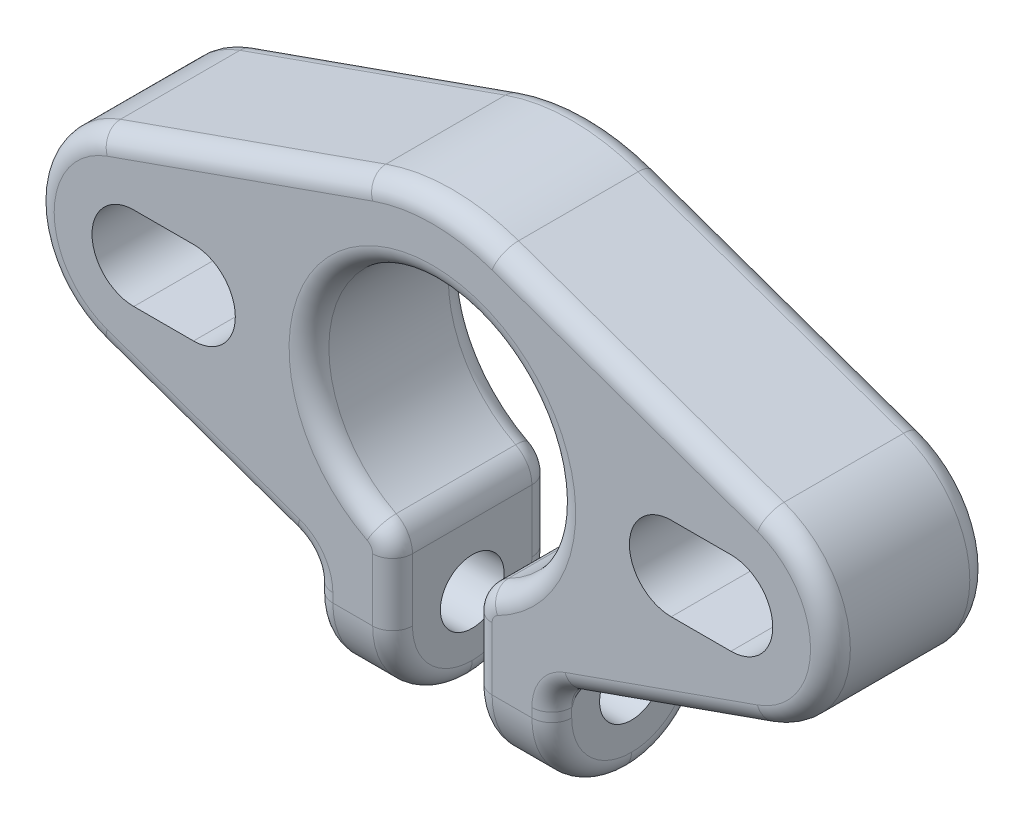
from build123d import *

# Parameters (mm, degrees)
EXTRUDE_1_DEPTH     = 8
FILLET_4_R          = 1.5
CUT_EXTRUDE_START   = 10
SKETCH_2_R          = 1.6
CUT_EXTRUDE_1_DEPTH = 41.594117082
SKETCH_2_3_R        = 3
CUT_EXTRUDE_2_DEPTH = 31.594117108
CUT_EXTRUDE_START_2 = -12
CUT_EXTRUDE_3_DEPTH = 19.594117108
FILLET_1_R          = 4
FILLET_2_R          = 1


with BuildPart() as part:
    # Эскиз1 → Бобышка-Вытянуть1 (new body)
    with BuildSketch(Plane.XY):
        with BuildLine():
            Line((-3.333333333, 9.428090416), (-16.666666667, 4.714045208))
            ThreePointArc((-16.666666667, 4.714045208), (-20, 0), (-16.666666667, -4.714045208))
            Line((-16.666666667, -4.714045208), (-6, -8.485281374))
            Line((-6, -8.485281374), (-6, -14))
            Line((-6, -14), (-2, -14))
            Line((-2, -14), (-2, -5.8685603))
            ThreePointArc((-2, -5.8685603), (0, 6.2), (2, -5.8685603))
            Line((2, -5.8685603), (2, -14))
            Line((2, -14), (6, -14))
            Line((6, -14), (6, -8.485281374))
            Line((6, -8.485281374), (16.666666667, -4.714045208))
            ThreePointArc((16.666666667, -4.714045208), (20, 0), (16.666666667, 4.714045208))
            Line((16.666666667, 4.714045208), (3.333333333, 9.428090416))
            ThreePointArc((3.333333333, 9.428090416), (0, 10), (-3.333333333, 9.428090416))
        make_face()
        with BuildLine():
            Line((-15, 2.1), (-12, 2.1))
            ThreePointArc((-12, 2.1), (-9.9, 0), (-12, -2.1))
            Line((-12, -2.1), (-15, -2.1))
            ThreePointArc((-15, -2.1), (-17.1, 0), (-15, 2.1))
        make_face(mode=Mode.SUBTRACT)
        with BuildLine():
            Line((12, 2.1), (15, 2.1))
            ThreePointArc((15, 2.1), (17.1, 0), (15, -2.1))
            Line((15, -2.1), (12, -2.1))
            ThreePointArc((12, -2.1), (9.9, 0), (12, 2.1))
        make_face(mode=Mode.SUBTRACT)
    extrude(amount=EXTRUDE_1_DEPTH)

    # Скругление4
    fillet_4_edges = [part.edges().sort_by_distance(p)[0] for p in [
        (6, -8.485281374, 4),
        (2, -5.8685603, 4),
        (-2, -5.8685603, 4),
        (-6, -8.485281374, 4),
    ]]
    fillet(fillet_4_edges, radius=FILLET_4_R)

    # Эскиз2 → Вырез-Вытянуть1 (cut, through all)
    with BuildSketch(Plane(origin=(6, 0, 0), x_dir=(0, 0, -1), z_dir=(1, 0, 0)).offset(CUT_EXTRUDE_START)):
        with Locations(Location((-4, -10, 0), (0, 0, 16.486327524))):
            Circle(SKETCH_2_R)
    extrude(amount=-CUT_EXTRUDE_1_DEPTH, mode=Mode.SUBTRACT)

    # Эскиз2<3> → Вырез-Вытянуть2 (cut, through all)
    with BuildSketch(Plane(origin=(6, 0, 0), x_dir=(0, 0, -1), z_dir=(1, 0, 0))):
        with Locations((-4, -10)):
            Circle(SKETCH_2_3_R)
    extrude(amount=CUT_EXTRUDE_2_DEPTH, mode=Mode.SUBTRACT)

    # Эскиз2<4> → Вырез-Вытянуть3 (cut, through all)
    with BuildSketch(Plane(origin=(6, 0, 0), x_dir=(0, 0, -1), z_dir=(1, 0, 0)).offset(CUT_EXTRUDE_START_2)):
        Polygon((-0.824573519, -10), (-2.41228676, -7.25), (-5.58771324, -7.25), (-7.175426481, -10), (-5.58771324, -12.75), (-2.41228676, -12.75), align=None)
    extrude(amount=-CUT_EXTRUDE_3_DEPTH, mode=Mode.SUBTRACT)

    # Скругление1
    fillet_1_edges = [part.edges().sort_by_distance(p)[0] for p in [
        (4, -14, 8),
        (4, -14, 0),
        (-4, -14, 0),
        (-4, -14, 8),
    ]]
    fillet(fillet_1_edges, radius=FILLET_1_R - 0.0001)  # a hair under: the kernel refuses the full size

    # Скругление2
    fillet_2_edges = [part.edges().sort_by_distance(p)[0] for p in [
        (10, 7.071067812, 8),
        (0, 10, 8),
        (-2, -8.42933564, 8),
        (6, -9.773020773, 8),
        (6, -9.773020773, 0),
        (6, -12.828456414, 1.171543586),
        (6, -12.828456414, 6.828456414),
        (2, -12.828456414, 1.171543586),
        (2, -12.828456414, 6.828456414),
        (-2, -8.42933564, 0),
        (-2, -12.828456414, 6.828456414),
        (-2, -12.828456414, 1.171543586),
        (-6, -12.828456414, 6.828456414),
        (-6, -12.828456414, 1.171543586),
        (-11.833333333, -6.422886596, 0),
        (-20, 0, 0),
        (-10, 7.071067812, 8),
        (-10, 7.071067812, 0),
        (0, 10, 0),
        (10, 7.071067812, 0),
        (20, 0, 0),
        (-20, 0, 8),
        (-11.833333333, -6.422886596, 8),
        (0, 6.2, 0),
        (0, 6.2, 8),
        (11.833333333, -6.422886596, 0),
        (2, -8.42933564, 0),
        (20, 0, 8),
        (-6, -9.773020773, 0),
        (2.220795702, -6.075221828, 0),
        (-2.220795702, -6.075221828, 0),
        (11.833333333, -6.422886596, 8),
        (-6, -9.773020773, 8),
        (2, -8.42933564, 8),
        (2.220795702, -6.075221828, 8),
        (-2.220795702, -6.075221828, 8),
        (-6.275255129, -8.679916142, 0),
        (-6.275255129, -8.679916142, 8),
        (6.275255129, -8.679916142, 0),
        (6.275255129, -8.679916142, 8),
    ]]
    fillet(fillet_2_edges, radius=FILLET_2_R)


solid = part.part
